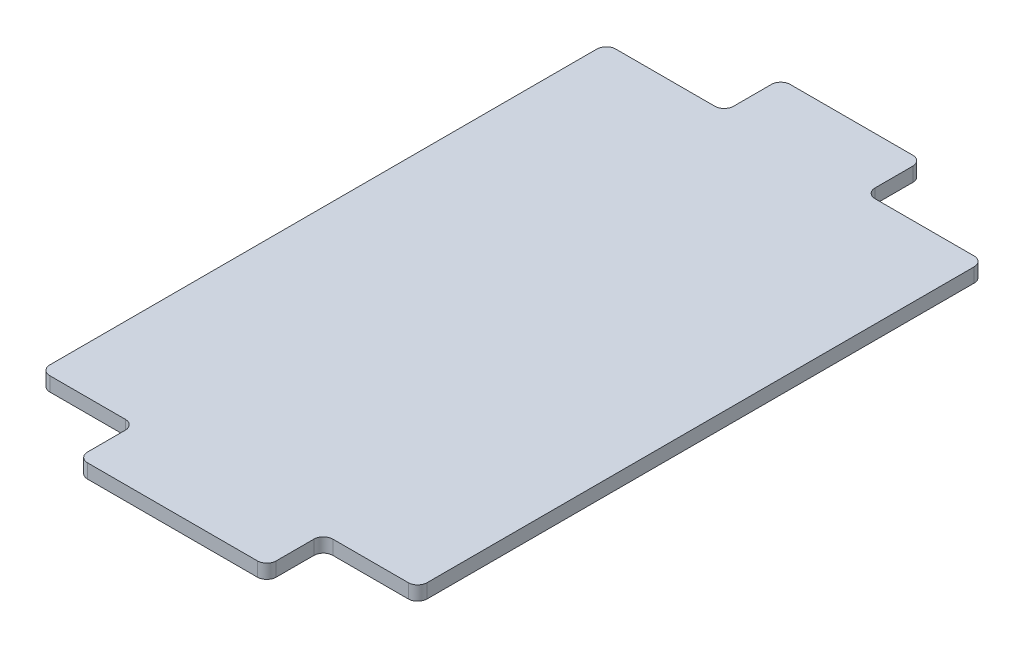
from build123d import *

# Parameters (mm, degrees)
SKETCH_1_W      = 40
SKETCH_1_H      = 60
EXTRUDE_1_DEPTH = 1.5
SKETCH_2_W      = 20
SKETCH_2_H      = 6
SKETCH_2_W_2    = 15
EXTRUDE_2_DEPTH = 1.5
FILLET_1_R      = 1


with BuildPart() as part:
    # Эскиз1 → Бобышка-Вытянуть1 (new body)
    with BuildSketch(Plane(origin=(0, 0, 0), x_dir=(1, 0, 0), z_dir=(0, 1, 0))):
        Rectangle(SKETCH_1_W, SKETCH_1_H)
    extrude(amount=EXTRUDE_1_DEPTH)

    # Эскиз2 → Бобышка-Вытянуть2 (add)
    with BuildSketch(Plane(origin=(0, 1.5, 0), x_dir=(1, 0, 0), z_dir=(0, 1, 0))):
        with Locations((0, -33)):
            Rectangle(SKETCH_2_W, SKETCH_2_H)
        with Locations((0, 33)):
            Rectangle(SKETCH_2_W_2, SKETCH_2_H)
    extrude(amount=-EXTRUDE_2_DEPTH)

    # Скругление1
    fillet_1_edges = [part.edges().sort_by_distance(p)[0] for p in [
        (-20, 0.75, -30),
        (20, 0.75, -30),
        (-20, 0.75, 30),
        (20, 0.75, 30),
        (10, 0.75, 30),
        (10, 0.75, 36),
        (-10, 0.75, 36),
        (-10, 0.75, 30),
        (7.5, 0.75, -30),
        (7.5, 0.75, -36),
        (-7.5, 0.75, -36),
        (-7.5, 0.75, -30),
    ]]
    fillet(fillet_1_edges, radius=FILLET_1_R)


solid = part.part
